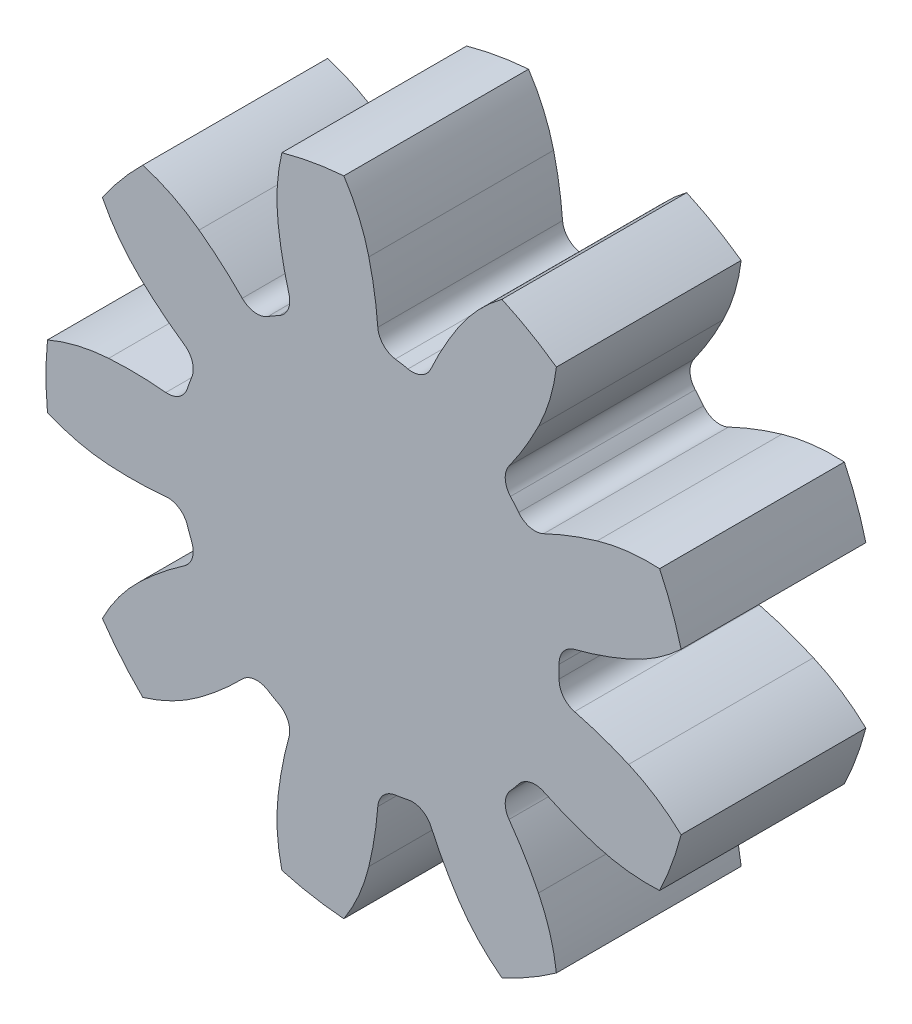
from build123d import *

# Parameters (mm, degrees)
SKETCH1_R                = 6.985
BLANK_DISK_DEPTH         = 2.000000064
GEAR_TOOTH_CUT_DEPTH     = 11.657412961
GEAR_TEETH_REVOLVE_COUNT = 9


with BuildPart() as part:
    # Sketch1 → BLANK DISK (new, symmetric)
    with BuildSketch(Plane.XY):
        Circle(SKETCH1_R)
    extrude(amount=BLANK_DISK_DEPTH, both=True)

    # Sketch2 → GEAR TOOTH CUT (cut, through all)
    with BuildSketch(Plane.XY.offset(2.000000064)):
        with BuildLine():
            ThreePointArc((-5.763009467, -3.946890786), (-6.563752956, -2.389010701), (-6.951733872, -0.680897326))
            ThreePointArc((-6.951733872, -0.680897326), (-6.303106227, -0.89616004), (-5.627259472, -0.997585))
            ThreePointArc((-5.627259472, -0.997585), (-5.00805343, -1.01182167), (-4.389706578, -0.976241119))
            ThreePointArc((-4.389706578, -0.976241119), (-4.103194142, -1.046520353), (-3.923782009, -1.280699416))
            ThreePointArc((-3.923782009, -1.280699416), (-3.878581292, -1.411688142), (-3.82900912, -1.541085788))
            ThreePointArc((-3.82900912, -1.541085788), (-3.815919388, -1.835801253), (-3.990226026, -2.073804914))
            ThreePointArc((-3.990226026, -2.073804914), (-4.486777934, -2.444014326), (-4.951966126, -2.852938219))
            ThreePointArc((-4.951966126, -2.852938219), (-5.404500069, -3.365060167), (-5.763009467, -3.946890786))
        make_face()
    gear_tooth_cut = extrude(amount=-GEAR_TOOTH_CUT_DEPTH, mode=Mode.SUBTRACT)

    # GEAR TEETH REVOLVE: GEAR TOOTH CUT ×9 about axis
    gear_teeth_revolve_axis = Axis((0, 0, 50), (0, 0, -1))
    for i in range(1, GEAR_TEETH_REVOLVE_COUNT):
        add(gear_tooth_cut.rotate(gear_teeth_revolve_axis, i * 360 / GEAR_TEETH_REVOLVE_COUNT), mode=Mode.SUBTRACT)


solid = part.part
